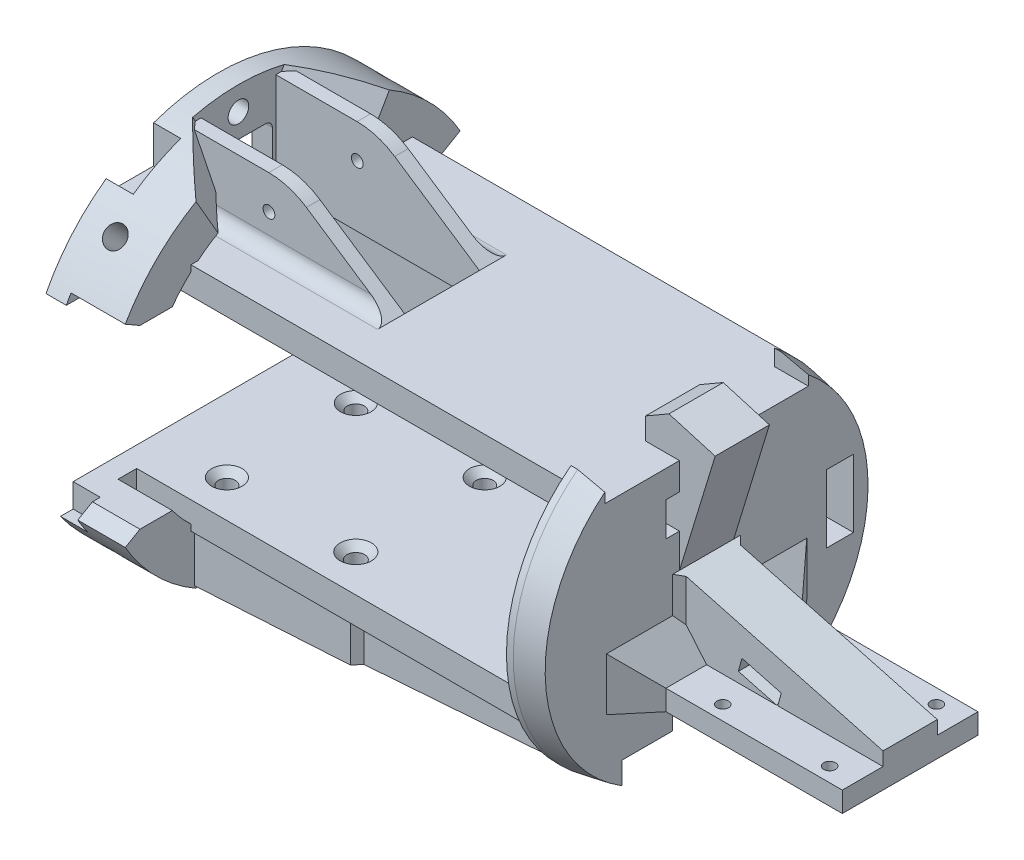
from build123d import *
from OCP.BRepFilletAPI import BRepFilletAPI_MakeChamfer
from build123d.topology import SkipClean

# Parameters (mm, degrees)
SKETCH1_R                 = 36.195
SKETCH1_R_2               = 27.94
SKETCH1_R_3               = 1.9304
BOSS_EXTRUDE1_DEPTH       = 3.81
BOSS_EXTRUDE2_DEPTH       = 10.16
CHAMFER1_SIZE             = 10.16
CHAMFER3_SIZE             = 6.35
BOSS_EXTRUDE3_DEPTH       = 3.81
SKETCH6_W                 = 5.08
SKETCH6_H                 = 38.1
BOSS_EXTRUDE4_DEPTH       = 81.28
SKETCH8_R                 = 31.115
BOSS_EXTRUDE5_DEPTH       = 6.35
CHAMFER2_SIZE             = 5.08
CHAMFER2_SIZE2            = 0.895741062
SKETCH9_W                 = 13.97
SKETCH9_H                 = 33.02
CUT_EXTRUDE2_DEPTH        = 113.797879634
CUT_EXTRUDE1_START        = -6.35
SKETCH4_R                 = 1.9685
CUT_EXTRUDE1_DEPTH        = 8.89
CIRPATTERN1_COUNT         = 4
BOSS_EXTRUDE6_START       = -9.525
SKETCH10_R                = 1.1
BOSS_EXTRUDE6_DEPTH       = 19.05
SKETCH11_W                = 38.1
SKETCH11_H                = 14
CUT_EXTRUDE3_DEPTH        = 17.78
SKETCH14_W                = 36.83
SKETCH14_H                = 8.89
SKETCH14_R                = 1.5875
BOSS_EXTRUDE8_DEPTH       = 3.81
CUT_EXTRUDE4_START        = -8.89
SKETCH15_R                = 1.5875
SKETCH15_R_2              = 1.657039105
CUT_EXTRUDE4_DEPTH        = 8.89
BOSS_EXTRUDE9_DEPTH       = 1.27
BOSS_EXTRUDE10_START      = 33.02
BOSS_EXTRUDE10_DEPTH      = 1.27
CUT_EXTRUDE7_DEPTH        = 115.063394079
CUT_EXTRUDE7_DEPTH_BACK   = 3.81
CHAMFER4_SIZE             = 1.27
CUT_EXTRUDE9_REACH        = 101.3
BOSS_EXTRUDE11_DEPTH      = 1.27
CHAMFER6_SIZE             = 1.27
BOSS_EXTRUDE12_DEPTH      = 1.27
CHAMFER7_SIZE             = 1.27
BOSS_EXTRUDE13_DEPTH      = 5.08
BOSS_EXTRUDE13_DEPTH_BACK = 5.08
CUT_EXTRUDE10_REACH       = 141.575
CHAMFER8_SIZE             = 1.27
CHAMFER9_SIZE             = 3.81
CHAMFER9_SIZE2            = 4.564309419
CUT_EXTRUDE11_REACH       = 106.792
SKETCH28_W                = 6.35
SKETCH28_H                = 2.54
BOSS_EXTRUDE14_REACH      = 101.3
SKETCH29_W                = 43.18
SKETCH29_H                = 3.355694031
CUT_EXTRUDE12_REACH       = 141.287
SKETCH30_R                = 1.27
SKETCH31_R                = 1.5875
SKETCH31_W                = 7.62
SKETCH31_H                = 3.175
CUT_EXTRUDE13_DEPTH       = 3.355694031
CHAMFER10_SIZE            = 0.762
CHAMFER10_SIZE2           = 1.319822715
SKETCH32_W                = 12.7
SKETCH32_H                = 5.08
CUT_EXTRUDE14_DEPTH       = 6.35
SKETCH33_W                = 38.1
SKETCH33_H                = 25.4
BOSS_EXTRUDE15_DEPTH      = 3.81
SKETCH34_R                = 1.1
CUT_EXTRUDE15_DEPTH       = 3.81
CUT_EXTRUDE16_START       = -6.350001
CUT_EXTRUDE16_DEPTH       = 6.350001
CHAMFER11_SIZE            = 5.08
CHAMFER11_SIZE_2          = 6.05410825
CHAMFER12_SIZE            = 5.08
CHAMFER12_SIZE2           = 6.05410825
FILLET1_R                 = 2.54
SKETCH36_W                = 8.89
SKETCH36_H                = 10.16
SKETCH36_W_2              = 10.16
SKETCH36_H_2              = 8.89
CUT_EXTRUDE17_DEPTH       = 5.08


with BuildPart() as part:
    # Sketch1 → Boss-Extrude1 (new body)
    with BuildSketch(Plane.YZ):
        with Locations(Location((0, 0, 0), (0, 0, 90))):
            Circle(SKETCH1_R)
        with Locations(Location((0, 0, 0), (0, 0, 90))):
            Circle(SKETCH1_R_2, mode=Mode.SUBTRACT)
        with Locations(Location((0, -31.75, 0), (0, 0, 90))):
            Circle(SKETCH1_R_3, mode=Mode.SUBTRACT)
        with Locations(Location((-31.75, 0, 0), (0, 0, 90))):
            Circle(SKETCH1_R_3, mode=Mode.SUBTRACT)
        with Locations(Location((0, 31.75, 0), (0, 0, 90))):
            Circle(SKETCH1_R_3, mode=Mode.SUBTRACT)
        with Locations(Location((31.75, 0, 0), (0, 0, 90))):
            Circle(SKETCH1_R_3, mode=Mode.SUBTRACT)
    extrude(amount=BOSS_EXTRUDE1_DEPTH)

    # Sketch2 → Boss-Extrude2 (add)
    with SkipClean():  # the faces are left unmerged after this step: merging them gives an invalid solid
        with BuildSketch(Plane.YZ.offset(3.81)):
            with BuildLine():
                Line((18.0975, 31.34578949), (13.97, 24.196749782))
                ThreePointArc((13.97, 24.196749782), (19.756563466, 19.756563466), (24.196749782, 13.97))
                Line((24.196749782, 13.97), (31.34578949, 18.0975))
                ThreePointArc((31.34578949, 18.0975), (25.593729945, 25.593729945), (18.0975, 31.34578949))
            make_face()
            with BuildLine():
                Line((18.0975, -31.34578949), (13.97, -24.196749782))
                ThreePointArc((13.97, -24.196749782), (19.756563466, -19.756563466), (24.196749782, -13.97))
                Line((24.196749782, -13.97), (31.34578949, -18.0975))
                ThreePointArc((31.34578949, -18.0975), (25.593729945, -25.593729945), (18.0975, -31.34578949))
            make_face()
            with BuildLine():
                Line((-31.34578949, -18.0975), (-24.196749782, -13.97))
                ThreePointArc((-24.196749782, -13.97), (-19.756563466, -19.756563466), (-13.97, -24.196749782))
                Line((-13.97, -24.196749782), (-18.0975, -31.34578949))
                ThreePointArc((-18.0975, -31.34578949), (-25.593729945, -25.593729945), (-31.34578949, -18.0975))
            make_face()
            with BuildLine():
                Line((-18.0975, 31.34578949), (-13.97, 24.196749782))
                ThreePointArc((-13.97, 24.196749782), (-19.756563466, 19.756563466), (-24.196749782, 13.97))
                Line((-24.196749782, 13.97), (-31.34578949, 18.0975))
                ThreePointArc((-31.34578949, 18.0975), (-25.593729945, 25.593729945), (-18.0975, 31.34578949))
            make_face()
        extrude(amount=BOSS_EXTRUDE2_DEPTH)

    # Chamfer1
    # the kernel refuses this chamfer: 10.16 mm, written as the material it adds along each edge
    with BuildSketch(Plane(origin=(3.81, -0.905850421, -1.568978953), x_dir=(0, 0.8660254037844386, -0.49999999999999983), z_dir=(0, -0.4999999999999999, -0.8660254037844387))) as chamfer1_piece_1_section:
        Polygon((CHAMFER1_SIZE, 0), (0, CHAMFER1_SIZE), (0, 0), align=None)
    chamfer1_piece_1 = extrude(amount=60.511598315, mode=Mode.PRIVATE)
    chamfer1_piece_1 = chamfer1_piece_1 & Plane(origin=(3.81, 0, 0), x_dir=(0, 0, 1), z_dir=(-1, 0, 0)) * Cylinder(36.195, 162, mode=Mode.PRIVATE)
    chamfer1_piece_1 = chamfer1_piece_1 - Plane(origin=(3.81, 0, 0), x_dir=(0, 0, 1), z_dir=(-1, 0, 0)) * Cylinder(27.94, 162, mode=Mode.PRIVATE)
    chamfer1_piece_1 = split(chamfer1_piece_1, bisect_by=Plane(origin=(13.97, -0.905850421, -1.568978953), z_dir=(-1, 0, 0)), keep=Keep.TOP, mode=Mode.PRIVATE)
    add(chamfer1_piece_1)
    with BuildSketch(Plane(origin=(3.81, 31.161649579, -53.973560318), x_dir=(0, -0.8660254037844388, -0.49999999999999967), z_dir=(0, -0.49999999999999967, 0.8660254037844388))) as chamfer1_piece_2_section:
        Polygon((CHAMFER1_SIZE, 0), (0, CHAMFER1_SIZE), (0, 0), align=None)
    chamfer1_piece_2 = extrude(amount=60.511598315, mode=Mode.PRIVATE)
    chamfer1_piece_2 = chamfer1_piece_2 & Plane(origin=(3.81, 0, 0), x_dir=(0, 0, 1), z_dir=(-1, 0, 0)) * Cylinder(36.195, 162, mode=Mode.PRIVATE)
    chamfer1_piece_2 = chamfer1_piece_2 - Plane(origin=(3.81, 0, 0), x_dir=(0, 0, 1), z_dir=(-1, 0, 0)) * Cylinder(27.94, 162, mode=Mode.PRIVATE)
    chamfer1_piece_2 = split(chamfer1_piece_2, bisect_by=Plane(origin=(13.97, 31.161649579, -53.973560318), z_dir=(-1, 0, 0)), keep=Keep.TOP, mode=Mode.PRIVATE)
    add(chamfer1_piece_2)
    with BuildSketch(Plane(origin=(3.81, 1.568978953, 0.905850421), x_dir=(0, 0.4999999999999985, -0.8660254037844395), z_dir=(0, 0.8660254037844395, 0.4999999999999985))) as chamfer1_piece_3_section:
        Polygon((CHAMFER1_SIZE, 0), (0, -CHAMFER1_SIZE), (0, 0), align=None)
    chamfer1_piece_3 = extrude(amount=60.511598315, mode=Mode.PRIVATE)
    chamfer1_piece_3 = chamfer1_piece_3 & Plane(origin=(3.81, 0, 0), x_dir=(0, 0, 1), z_dir=(-1, 0, 0)) * Cylinder(36.195, 162, mode=Mode.PRIVATE)
    chamfer1_piece_3 = chamfer1_piece_3 - Plane(origin=(3.81, 0, 0), x_dir=(0, 0, 1), z_dir=(-1, 0, 0)) * Cylinder(27.94, 162, mode=Mode.PRIVATE)
    chamfer1_piece_3 = split(chamfer1_piece_3, bisect_by=Plane(origin=(13.97, 1.568978953, 0.905850421), z_dir=(-1, 0, 0)), keep=Keep.TOP, mode=Mode.PRIVATE)
    add(chamfer1_piece_3)
    with BuildSketch(Plane(origin=(3.81, 1.568978953, -0.905850421), x_dir=(0, 0.49999999999999956, 0.8660254037844389), z_dir=(0, 0.8660254037844389, -0.49999999999999956))) as chamfer1_piece_4_section:
        Polygon((CHAMFER1_SIZE, 0), (0, CHAMFER1_SIZE), (0, 0), align=None)
    chamfer1_piece_4 = extrude(amount=60.511598315, mode=Mode.PRIVATE)
    chamfer1_piece_4 = chamfer1_piece_4 & Plane(origin=(3.81, 0, 0), x_dir=(0, 0, 1), z_dir=(-1, 0, 0)) * Cylinder(36.195, 162, mode=Mode.PRIVATE)
    chamfer1_piece_4 = chamfer1_piece_4 - Plane(origin=(3.81, 0, 0), x_dir=(0, 0, 1), z_dir=(-1, 0, 0)) * Cylinder(27.94, 162, mode=Mode.PRIVATE)
    chamfer1_piece_4 = split(chamfer1_piece_4, bisect_by=Plane(origin=(13.97, 1.568978953, -0.905850421), z_dir=(-1, 0, 0)), keep=Keep.TOP, mode=Mode.PRIVATE)
    add(chamfer1_piece_4)

    # Chamfer3
    # the kernel refuses this chamfer: 6.35, 3.666174209 mm, written as the material it takes off along each edge
    with BuildSketch(Plane(origin=(3.81, -24.196749782, -13.97), x_dir=(0, 0.5581282358487009, -0.8297547061321296), z_dir=(1, 0, 0))) as chamfer3_piece_1:
        with BuildLine():
            Line((3.826432049, 0), (-CHAMFER3_SIZE * 0.0684758777483, -CHAMFER3_SIZE * 0.997652772344))
            Line((-CHAMFER3_SIZE * 0.0684758777483, -CHAMFER3_SIZE * 0.997652772344), (0, 0))
            ThreePointArc((0, 0), (1.984534465, -0.065490518), (3.826432049, 0))
        make_face()
    extrude(amount=26.587994542, mode=Mode.SUBTRACT)
    with BuildSketch(Plane(origin=(3.81, -24.196749782, 13.97), x_dir=(0, 0.5581282358486983, 0.8297547061321314), z_dir=(1, 0, 0))) as chamfer3_piece_2:
        with BuildLine():
            Line((3.826432049, 0), (-CHAMFER3_SIZE * 0.0684758777483, CHAMFER3_SIZE * 0.997652772344))
            Line((-CHAMFER3_SIZE * 0.0684758777483, CHAMFER3_SIZE * 0.997652772344), (0, 0))
            ThreePointArc((0, 0), (1.984534465, 0.065490518), (3.826432049, 0))
        make_face()
    extrude(amount=26.587994542, mode=Mode.SUBTRACT)

    # Sketch5 → Boss-Extrude3 (add)
    with SkipClean():  # the faces are left unmerged after this step: merging them gives an invalid solid
        with BuildSketch(Plane(origin=(0, 0, 0), x_dir=(0, -1, 0), z_dir=(-1, 0, 0))):
            with BuildLine():
                Line((-16.51, -19.05), (16.51, -19.05))
                Line((16.51, -19.05), (16.51, 19.05))
                Line((16.51, 19.05), (16.51, 22.540263974))
                ThreePointArc((16.51, 22.540263974), (0, -27.94), (-16.51, 22.540263974))
                Line((-16.51, 22.540263974), (-16.51, 19.05))
                Line((-16.51, 19.05), (-16.51, -19.05))
            make_face()
        extrude(amount=-BOSS_EXTRUDE3_DEPTH)

    # Sketch6 → Boss-Extrude4 (add)
    with SkipClean():  # the faces are left unmerged after this step: merging them gives an invalid solid
        with BuildSketch(Plane.YZ.offset(3.81)):
            with Locations((-19.05, 0)):
                Rectangle(SKETCH6_W, SKETCH6_H)
            with Locations((19.05, 0)):
                Rectangle(SKETCH6_W, SKETCH6_H)
        extrude(amount=BOSS_EXTRUDE4_DEPTH)
    add(part.part.scale(1), mode=Mode.REPLACE)  # the faces are merged on a copy

    # Sketch8 → Boss-Extrude5 (add)
    with BuildSketch(Plane.YZ.offset(85.09)):
        with Locations(Location((0, 0, 0), (0, 0, 270))):
            Circle(SKETCH8_R)
    extrude(amount=BOSS_EXTRUDE5_DEPTH)

    # Chamfer2
    chamfer2_edges = [part.edges().sort_by_distance(p)[0] for p in [
        (91.44, 0, 31.115),
    ]]
    chamfer2_side = [part.faces().sort_by_distance(p)[0] for p in [
        (88.265, 0, 31.115),
    ]]
    chamfer(chamfer2_edges, length=CHAMFER2_SIZE, length2=CHAMFER2_SIZE2, reference=chamfer2_side[0])

    # Sketch9 → Cut-Extrude2 (cut, through all)
    with SkipClean():  # the faces are left unmerged after this step: merging them gives an invalid solid
        with BuildSketch(Plane.XY.offset(-19.05)):
            with Locations((6.985, 0)):
                Rectangle(SKETCH9_W, SKETCH9_H)
        extrude(amount=CUT_EXTRUDE2_DEPTH, mode=Mode.SUBTRACT)

    # Sketch4 → Cut-Extrude1 (cut)
    with SkipClean():  # the faces are left unmerged after this step: merging them gives an invalid solid
        with BuildSketch(Plane(origin=(0, 24.721644745, 24.721644745), x_dir=(1, 0, 0), z_dir=(0, 0.7071067811865476, 0.7071067811865475)).offset(CUT_EXTRUDE1_START)):
            with Locations(Location((6.35, 0, 0), (0, 0, 90))):
                Circle(SKETCH4_R)
        cut_extrude1 = extrude(amount=CUT_EXTRUDE1_DEPTH, mode=Mode.SUBTRACT)

    # CirPattern1: Cut-Extrude1 ×4 about axis
    with SkipClean():  # the faces are left unmerged after this step: merging them gives an invalid solid
        cirpattern1_axis = Axis((0, 0, 0), (1, 0, 0))
        for i in range(1, CIRPATTERN1_COUNT):
            add(cut_extrude1.rotate(cirpattern1_axis, i * 360 / CIRPATTERN1_COUNT), mode=Mode.SUBTRACT)

    # Sketch10 → Boss-Extrude6 (add)
    with SkipClean():  # the faces are left unmerged after this step: merging them gives an invalid solid
        with BuildSketch(Plane.XY.offset(19.05).offset(BOSS_EXTRUDE6_START)):
            with BuildLine():
                Line((3.81, 34.29), (19.014749401, 34.29))
                ThreePointArc((19.014749401, 34.29), (22.695008089, 33.745068736), (26.059441893, 32.157038738))
                Line((26.059441893, 32.157038738), (41.91, 21.59))
                Line((41.91, 21.59), (3.81, 21.59))
                Line((3.81, 21.59), (3.81, 34.29))
            make_face()
            with Locations((19.05, 27.94)):
                Circle(SKETCH10_R, mode=Mode.SUBTRACT)
        extrude(amount=-BOSS_EXTRUDE6_DEPTH)

    # Sketch11 → Cut-Extrude3 (cut)
    with SkipClean():  # the faces are left unmerged after this step: merging them gives an invalid solid
        with BuildSketch(Plane(origin=(0, 34.29, 0), x_dir=(-1, 0, 0), z_dir=(0, 1, 0))):
            with Locations((-22.86, 0)):
                Rectangle(SKETCH11_W, SKETCH11_H)
        extrude(amount=-CUT_EXTRUDE3_DEPTH, mode=Mode.SUBTRACT)

    # Sketch14 → Boss-Extrude8 (add)
    # profile 1 of 2: a face of its own
    with SkipClean():  # the faces are left unmerged after this step: merging them gives an invalid solid
        with BuildSketch(Plane.XZ.offset(21.59)):
            with Locations((22.225, 12.7)):
                Rectangle(SKETCH14_W, SKETCH14_H)
            with Locations(Location((37.846, 12.065, 0), (0, 0, 90))):
                Circle(SKETCH14_R, mode=Mode.SUBTRACT)
            with Locations(Location((13.716, 12.065, 0), (0, 0, 90))):
                Circle(SKETCH14_R, mode=Mode.SUBTRACT)
        # profile 2 of 2: a face of its own
        with BuildSketch(Plane.XZ.offset(21.59)):
            with Locations((22.225, -12.7)):
                Rectangle(SKETCH14_W, SKETCH14_H)
            with Locations(Location((13.716, -12.065, 0), (0, 0, 90))):
                Circle(SKETCH14_R, mode=Mode.SUBTRACT)
            with Locations(Location((37.846, -12.065, 0), (0, 0, 90))):
                Circle(SKETCH14_R, mode=Mode.SUBTRACT)
        extrude(amount=BOSS_EXTRUDE8_DEPTH)

    # Sketch15 → Cut-Extrude4 (cut)
    with SkipClean():  # the faces are left unmerged after this step: merging them gives an invalid solid
        with BuildSketch(Plane.XZ.offset(25.4).offset(CUT_EXTRUDE4_START)):
            with Locations(Location((13.716, 12.065, 0), (0, 0, 90))):
                Circle(SKETCH15_R)
            with Locations(Location((37.846, 12.065, 0), (0, 0, 270))):
                Circle(SKETCH15_R_2)
            with Locations(Location((37.846, -12.065, 0), (0, 0, 90))):
                Circle(SKETCH15_R)
            with Locations(Location((13.716, -12.065, 0), (0, 0, 90))):
                Circle(SKETCH15_R)
        extrude(amount=CUT_EXTRUDE4_DEPTH, mode=Mode.SUBTRACT)

    # Sketch18 → Boss-Extrude9 (add)
    with SkipClean():  # the faces are left unmerged after this step: merging them gives an invalid solid
        with BuildSketch(Plane(origin=(0, 0, 17.145), x_dir=(1, 0, 0), z_dir=(0, 0, -1))):
            Polygon((85.09, 25.965211341), (85.09, 21.59), (40.64, 21.59), (40.64, 29.198082411), align=None)
        extrude(amount=BOSS_EXTRUDE9_DEPTH)

    # Sketch20 → Boss-Extrude10 (add)
    with SkipClean():  # the faces are left unmerged after this step: merging them gives an invalid solid
        with BuildSketch(Plane(origin=(0, 0, 15.875), x_dir=(1, 0, 0), z_dir=(0, 0, -1)).offset(BOSS_EXTRUDE10_START)):
            Polygon((40.64, 21.59), (40.64, 29.198082411), (85.09, 25.965211341), (85.09, 21.59), align=None)
        extrude(amount=-BOSS_EXTRUDE10_DEPTH)

    # Sketch21 → Cut-Extrude7 (cut, two sides: drawn at the far end of the back side and taken through both)
    with SkipClean():  # the faces are left unmerged after this step: merging them gives an invalid solid
        with BuildSketch(Plane.XZ.offset(21.59).offset(-CUT_EXTRUDE7_DEPTH_BACK)):
            with BuildLine():
                Line((36.398522628, 6.35), (91.44, 6.35))
                Line((91.44, 6.35), (91.44, -6.35))
                Line((91.44, -6.35), (36.398522628, -6.35))
                ThreePointArc((36.398522628, -6.35), (12.7, 0), (36.398522628, 6.35))
            make_face()
        extrude(amount=CUT_EXTRUDE7_DEPTH + CUT_EXTRUDE7_DEPTH_BACK, mode=Mode.SUBTRACT)
    add(part.part.scale(1), mode=Mode.REPLACE)  # the faces are merged on a copy

    # Chamfer4
    chamfer4_edges = [part.edges().sort_by_distance(p)[0] for p in [
        (12.133621195, -16.51, -12.192411022),
        (37.846, -16.51, -13.6525),
        (37.846, -16.51, 13.722039105),
        (12.133621195, -16.51, 11.937588978),
    ]]
    chamfer(chamfer4_edges, length=CHAMFER4_SIZE)

    # Sketch23 → Cut-Extrude9 (cut, up to next)
    with BuildSketch(Plane(origin=(85.09, 0, 0), x_dir=(0, -1, 0), z_dir=(-1, 0, 0)), mode=Mode.PRIVATE) as cut_extrude9_sk1:
        with BuildLine():
            Line((-24.601640697, 19.05), (-21.59, 19.05))
            Line((-21.59, 19.05), (-21.59, -19.05))
            Line((-21.59, -19.05), (-24.601640697, -19.05))
            ThreePointArc((-24.601640697, -19.05), (-31.115, 0), (-24.601640697, 19.05))
        make_face()
    cut_extrude9_tool1 = extrude(cut_extrude9_sk1.sketch, amount=-CUT_EXTRUDE9_REACH, mode=Mode.PRIVATE) & part.part
    add(cut_extrude9_tool1.solids().sort_by_distance((85.09, 25.56073, 0))[0], mode=Mode.SUBTRACT)

    # Sketch24 → Boss-Extrude11 (add)
    with SkipClean():  # the faces are left unmerged after this step: merging them gives an invalid solid
        with BuildSketch(Plane.XY.offset(17.145)):
            Polygon((43.18, -29.013346921), (3.81, -31.34578949), (3.81, -21.59), (43.18, -21.59), align=None)
        extrude(amount=BOSS_EXTRUDE11_DEPTH)

    # Chamfer6
    # the kernel refuses this chamfer: 1.27 mm, written as the material it adds along each edge
    with BuildSketch(Plane(origin=(43.18, -18.323962605, 17.145), x_dir=(1, 0, 0), z_dir=(0, -1, 0))) as chamfer6_piece_1_section:
        Polygon((CHAMFER6_SIZE, 0), (0, CHAMFER6_SIZE), (0, 0), align=None)
    chamfer6_piece_1 = extrude(amount=13.95542171, mode=Mode.PRIVATE)
    chamfer6_piece_1 = split(chamfer6_piece_1, bisect_by=Plane(origin=(43.95335352, -28.957100527, 17.145), z_dir=(-0.07253890529908057, 0.9973655835339473, -1.812888966709246e-15)), keep=Keep.TOP, mode=Mode.PRIVATE)
    add(chamfer6_piece_1)
    with BuildSketch(Plane(origin=(40.64, -22.133962605, 17.145), x_dir=(-1, 0, 0), z_dir=(0, -1, 0))) as chamfer6_piece_2_section:
        Polygon((CHAMFER6_SIZE, 0), (0, CHAMFER6_SIZE), (0, 0), align=None)
    chamfer6_piece_2 = extrude(amount=10.295901876, mode=Mode.PRIVATE)
    chamfer6_piece_2 = split(chamfer6_piece_2, bisect_by=Plane(origin=(41.055021742, -29.139239472, 17.145), z_dir=(-0.059140462969697195, 0.9982496709940505, 0)), keep=Keep.TOP, mode=Mode.PRIVATE)
    add(chamfer6_piece_2)

    # Sketch25 → Boss-Extrude12 (add)
    with SkipClean():  # the faces are left unmerged after this step: merging them gives an invalid solid
        with BuildSketch(Plane(origin=(0, 0, -17.145), x_dir=(1, 0, 0), z_dir=(0, 0, -1))):
            Polygon((43.18, 29.013346921), (3.81, 31.34578949), (3.81, 21.59), (43.18, 21.59), align=None)
        extrude(amount=BOSS_EXTRUDE12_DEPTH)

    # Chamfer7
    # the kernel refuses this chamfer: 1.27 mm, written as the material it adds along each edge
    with BuildSketch(Plane(origin=(40.64, -22.133962605, -17.145), x_dir=(-1, 0, 0), z_dir=(0, -1, 0))) as chamfer7_piece_1_section:
        Polygon((CHAMFER7_SIZE, 0), (0, -CHAMFER7_SIZE), (0, 0), align=None)
    chamfer7_piece_1 = extrude(amount=10.295901876, mode=Mode.PRIVATE)
    chamfer7_piece_1 = split(chamfer7_piece_1, bisect_by=Plane(origin=(41.055021742, -29.139239472, -17.145), z_dir=(-0.059140462969697195, 0.9982496709940505, 0)), keep=Keep.TOP, mode=Mode.PRIVATE)
    add(chamfer7_piece_1)
    with BuildSketch(Plane(origin=(43.18, -18.323962605, -17.145), x_dir=(0, 0, -1), z_dir=(0, -1, 0))) as chamfer7_piece_2_section:
        Polygon((CHAMFER7_SIZE, 0), (0, CHAMFER7_SIZE), (0, 0), align=None)
    chamfer7_piece_2 = extrude(amount=13.95542171, mode=Mode.PRIVATE)
    chamfer7_piece_2 = split(chamfer7_piece_2, bisect_by=Plane(origin=(43.95335352, -28.957100527, -17.145), z_dir=(-0.07253890529908057, 0.9973655835339473, -2.0261072986436667e-15)), keep=Keep.TOP, mode=Mode.PRIVATE)
    add(chamfer7_piece_2)

    # Sketch26 → Boss-Extrude13 (add, two sides: drawn at the far end of the back side and taken through both)
    with SkipClean():  # the faces are left unmerged after this step: merging them gives an invalid solid
        with BuildSketch(Plane(origin=(0, 0, 0), x_dir=(0, 1, 0), z_dir=(0, 0, 1)).offset(-BOSS_EXTRUDE13_DEPTH_BACK)):
            Polygon((3.792873279, -91.44), (-6.415990953, -129.54), (-12.765990953, -129.54), (-12.765990953, -85.09), (29.464, -85.09), (25.654, -98.12361717), align=None)
        extrude(amount=BOSS_EXTRUDE13_DEPTH + BOSS_EXTRUDE13_DEPTH_BACK)

    # Sketch27 → Cut-Extrude10 (cut, up to next)
    with BuildSketch(Plane(origin=(0, 0, -5.08), x_dir=(1, 0, 0), z_dir=(0, 0, -1)), mode=Mode.PRIVATE) as cut_extrude10_sk1:
        Polygon((103.129645204, 4.59856071), (110.49, 6.570761834), (109.832599625, 9.024213432), (102.472244829, 7.052012309), align=None)
    cut_extrude10_tool1 = extrude(cut_extrude10_sk1.sketch, amount=-CUT_EXTRUDE10_REACH, mode=Mode.PRIVATE) & part.part
    add(cut_extrude10_tool1.solids().sort_by_distance((106.481122, -6.811387, -5.08))[0], mode=Mode.SUBTRACT)

    # Chamfer8
    # the kernel refuses this chamfer: 1.27 mm, written as the material it adds along each edge
    with BuildSketch(Plane(origin=(91.44, -12.765990953, -5.08), x_dir=(0, 0, -1), z_dir=(0, 1, 0))) as chamfer8_piece_1_section:
        Polygon((CHAMFER8_SIZE, 0), (0, -CHAMFER8_SIZE), (0, 0), align=None)
    chamfer8_piece_1 = extrude(amount=22.111127803, mode=Mode.PRIVATE)
    chamfer8_piece_1 = split(chamfer8_piece_1, bisect_by=Plane(origin=(95.579716058, 2.683639704, -5.08), z_dir=(-0.25881904510251785, -0.9659258262890691, 0)), keep=Keep.TOP, mode=Mode.PRIVATE)
    add(chamfer8_piece_1)
    with BuildSketch(Plane(origin=(91.44, -12.765990953, 5.08), x_dir=(0, 0, 1), z_dir=(0, 1, 0))) as chamfer8_piece_2_section:
        Polygon((CHAMFER8_SIZE, 0), (0, CHAMFER8_SIZE), (0, 0), align=None)
    chamfer8_piece_2 = extrude(amount=22.111127803, mode=Mode.PRIVATE)
    chamfer8_piece_2 = split(chamfer8_piece_2, bisect_by=Plane(origin=(95.579716058, 2.683639704, 5.08), z_dir=(-0.25881904510251785, -0.9659258262890691, 0)), keep=Keep.TOP, mode=Mode.PRIVATE)
    add(chamfer8_piece_2)

    # Chamfer9
    chamfer9_edges = [part.edges().sort_by_distance(p)[0] for p in [
        (85.09, 29.464, 0),
    ]]
    chamfer9_side = [part.faces().sort_by_distance(p)[0] for p in [
        (85.09, 25.527, 0),
    ]]
    chamfer(chamfer9_edges, length=CHAMFER9_SIZE, length2=CHAMFER9_SIZE2, reference=chamfer9_side[0])

    # Sketch28 → Cut-Extrude11 (cut, up to next)
    with BuildSketch(Plane.YZ.offset(91.44), mode=Mode.PRIVATE) as cut_extrude11_sk1:
        with Locations((13.335, 6.35)):
            Rectangle(SKETCH28_W, SKETCH28_H)
    cut_extrude11_tool1 = extrude(cut_extrude11_sk1.sketch, amount=-CUT_EXTRUDE11_REACH, mode=Mode.PRIVATE) & part.part
    # Sketch28 → Cut-Extrude11 (cut, up to next)
    with BuildSketch(Plane.YZ.offset(91.44), mode=Mode.PRIVATE) as cut_extrude11_sk2:
        with Locations((13.335, -6.35)):
            Rectangle(SKETCH28_W, SKETCH28_H)
    cut_extrude11_tool2 = extrude(cut_extrude11_sk2.sketch, amount=-CUT_EXTRUDE11_REACH, mode=Mode.PRIVATE) & part.part
    add(cut_extrude11_tool1.solids().sort_by_distance((91.44, 13.335, 6.35))[0], mode=Mode.SUBTRACT)
    add(cut_extrude11_tool2.solids().sort_by_distance((91.44, 13.335, -6.35))[0], mode=Mode.SUBTRACT)

    # Boss-Extrude14: up to this face of the body (flat: up to its plane)
    boss_extrude14_end = Plane(part.part.faces().sort_by_distance((3.81, -29.009691657, 0))[0])
    # Sketch29 → Boss-Extrude14 (add, up to the picked face)
    with BuildSketch(Plane(origin=(85.09, 0, 0), x_dir=(0, -1, 0), z_dir=(-1, 0, 0)), mode=Mode.PRIVATE) as boss_extrude14_sk1:
        with Locations((0, -20.727847016)):
            Rectangle(SKETCH29_W, SKETCH29_H)
    boss_extrude14_tool1 = split(extrude(boss_extrude14_sk1.sketch, amount=BOSS_EXTRUDE14_REACH, mode=Mode.PRIVATE), bisect_by=boss_extrude14_end, keep=Keep.BOTH, mode=Mode.PRIVATE)
    add(boss_extrude14_tool1.solids().sort_by(Axis((85.09, 0, -20.727847), (-1, 0, 0)))[0])

    # Sketch30 → Cut-Extrude12 (cut, up to next)
    with BuildSketch(Plane(origin=(0, 0, 0), x_dir=(0, -1, 0), z_dir=(-1, 0, 0)), mode=Mode.PRIVATE) as cut_extrude12_sk1:
        with Locations(Location((23.495, 0, 0), (0, 0, 90))):
            Circle(SKETCH30_R)
    cut_extrude12_tool1 = extrude(cut_extrude12_sk1.sketch, amount=-CUT_EXTRUDE12_REACH, mode=Mode.PRIVATE) & part.part
    # Sketch30 → Cut-Extrude12 (cut, up to next)
    with BuildSketch(Plane(origin=(0, 0, 0), x_dir=(0, -1, 0), z_dir=(-1, 0, 0)), mode=Mode.PRIVATE) as cut_extrude12_sk2:
        with BuildLine():
            Line((-26.035, -6.35), (-20.955, -6.35))
            ThreePointArc((-20.955, -6.35), (-20.056974388, -5.978025612), (-19.685, -5.08))
            Line((-19.685, -5.08), (-19.685, 5.08))
            ThreePointArc((-19.685, 5.08), (-20.056974388, 5.978025612), (-20.955, 6.35))
            Line((-20.955, 6.35), (-26.035, 6.35))
            ThreePointArc((-26.035, 6.35), (-26.933025612, 5.978025612), (-27.305, 5.08))
            Line((-27.305, 5.08), (-27.305, -5.08))
            ThreePointArc((-27.305, -5.08), (-26.933025612, -5.978025612), (-26.035, -6.35))
        make_face()
    cut_extrude12_tool2 = extrude(cut_extrude12_sk2.sketch, amount=-CUT_EXTRUDE12_REACH, mode=Mode.PRIVATE) & part.part
    add(cut_extrude12_tool1.solids().sort_by_distance((0, -23.495, 0))[0], mode=Mode.SUBTRACT)
    add(cut_extrude12_tool2.solids().sort_by_distance((0, 23.495, 0))[0], mode=Mode.SUBTRACT)

    # Sketch31 → Cut-Extrude13 (cut)
    with SkipClean():  # the faces are left unmerged after this step: merging them gives an invalid solid
        with BuildSketch(Plane(origin=(0, 0, -22.405694031), x_dir=(1, 0, 0), z_dir=(0, 0, -1))):
            with Locations(Location((60.021234746, 12.385288595, 0), (0, 0, 180))):
                Circle(SKETCH31_R)
            with Locations(Location((79.678765254, -12.385288595, 0), (0, 0, 180))):
                Circle(SKETCH31_R)
            with Locations((29.21, 14.2875)):
                Rectangle(SKETCH31_W, SKETCH31_H)
            with Locations((29.21, -14.2875)):
                Rectangle(SKETCH31_W, SKETCH31_H)
        extrude(amount=-CUT_EXTRUDE13_DEPTH, mode=Mode.SUBTRACT)

    # Chamfer10: one chamfer whose edges measure the first distance from different faces: ONE call of the kernel's chamfer builder (chamfer() names one face for all edges)
    chamfer10_edges_1 = [part.edges().sort_by_distance(p)[0] for p in [
        (81.266265254, 12.385288595, -19.05),
    ]]
    chamfer10_side_1 = [part.faces().sort_by_distance(p)[0] for p in [
        (81.266265254, 12.385288595, -20.727847015),
    ]]
    chamfer10_edges_2 = [part.edges().sort_by_distance(p)[0] for p in [
        (61.608734746, -12.385288595, -19.05),
    ]]
    chamfer10_side_2 = [part.faces().sort_by_distance(p)[0] for p in [
        (61.608734746, -12.385288595, -20.727847015),
    ]]
    chamfer10 = BRepFilletAPI_MakeChamfer(part.part.solid().wrapped)
    for e in chamfer10_edges_1:
        chamfer10.Add(CHAMFER10_SIZE, CHAMFER10_SIZE2, e.wrapped, chamfer10_side_1[0].wrapped)  # the first distance lies on this face
    for e in chamfer10_edges_2:
        chamfer10.Add(CHAMFER10_SIZE, CHAMFER10_SIZE2, e.wrapped, chamfer10_side_2[0].wrapped)  # the first distance lies on this face
    add(Compound.cast(chamfer10.Shape()), mode=Mode.REPLACE)

    # Sketch32 → Cut-Extrude14 (cut)
    with SkipClean():  # the faces are left unmerged after this step: merging them gives an invalid solid
        with BuildSketch(Plane(origin=(85.09, 0, 0), x_dir=(0, -1, 0), z_dir=(-1, 0, 0))):
            with Locations((0, -24.945694031)):
                Rectangle(SKETCH32_W, SKETCH32_H)
        extrude(amount=-CUT_EXTRUDE14_DEPTH, mode=Mode.SUBTRACT)

    # Sketch33 → Boss-Extrude15 (add)
    with SkipClean():  # the faces are left unmerged after this step: merging them gives an invalid solid
        with BuildSketch(Plane.XZ.offset(12.765990953)):
            with Locations((110.49, 0)):
                Rectangle(SKETCH33_W, SKETCH33_H)
        extrude(amount=-BOSS_EXTRUDE15_DEPTH)

    # Sketch34 → Cut-Extrude15 (cut)
    with SkipClean():  # the faces are left unmerged after this step: merging them gives an invalid solid
        with BuildSketch(Plane.XZ.offset(12.765990953)):
            with Locations((104.46, 10)):
                Circle(SKETCH34_R)
            with Locations((124.46, 10)):
                Circle(SKETCH34_R)
            with Locations((124.46, -10)):
                Circle(SKETCH34_R)
            with Locations((104.46, -10)):
                Circle(SKETCH34_R)
        extrude(amount=-CUT_EXTRUDE15_DEPTH, mode=Mode.SUBTRACT)

    # Sketch35 → Cut-Extrude16 (cut)
    with SkipClean():  # the faces are left unmerged after this step: merging them gives an invalid solid
        with BuildSketch(Plane(origin=(85.09, 0, 0), x_dir=(0, -1, 0), z_dir=(-1, 0, 0)).offset(CUT_EXTRUDE16_START)):
            with BuildLine():
                Line((26.760560532, 15.875), (21.59, 15.875))
                Line((21.59, 15.875), (21.59, -15.875))
                Line((21.59, -15.875), (26.760560532, -15.875))
                ThreePointArc((26.760560532, -15.875), (31.115, 0), (26.760560532, 15.875))
            make_face()
        extrude(amount=CUT_EXTRUDE16_DEPTH, mode=Mode.SUBTRACT)

    # Chamfer11
    # the kernel refuses this chamfer: 6.05410825, 5.08 mm, written as the material it takes off along each edge
    with BuildSketch(Plane(origin=(91.44, -17.78, 6.35), x_dir=(0, 1, 0), z_dir=(0, 0, -1))) as chamfer11_piece_1_section:
        Polygon((CHAMFER11_SIZE, 0), (0, -CHAMFER11_SIZE_2), (0, 0), align=None)
    chamfer11_piece_1 = extrude(amount=12.7, mode=Mode.PRIVATE)
    chamfer11_piece_1 = split(chamfer11_piece_1, bisect_by=Plane(origin=(91.44, -12.765990953, 6.35), z_dir=(0, -1, 0)), keep=Keep.TOP, mode=Mode.PRIVATE)
    add(chamfer11_piece_1, mode=Mode.SUBTRACT)

    # Chamfer12: one chamfer whose edges measure the first distance from different faces: ONE call of the kernel's chamfer builder (chamfer() names one face for all edges)
    chamfer12_edges_1 = [part.edges().sort_by_distance(p)[0] for p in [
        (91.44, -10.860990953, 12.7),
    ]]
    chamfer12_side_1 = [part.faces().sort_by_distance(p)[0] for p in [
        (110.49, -10.860990953, 12.7),
    ]]
    chamfer12_edges_2 = [part.edges().sort_by_distance(p)[0] for p in [
        (91.44, -8.955990953, 9.525),
        (91.44, -8.955990953, -9.525),
    ]]
    chamfer12_side_2 = [part.faces().sort_by_distance(p)[0] for p in [
        (91.897905012, -8.955990953, -9.525),
    ]]
    chamfer12_edges_3 = [part.edges().sort_by_distance(p)[0] for p in [
        (91.44, -10.860990953, -12.7),
    ]]
    chamfer12_side_3 = [part.faces().sort_by_distance(p)[0] for p in [
        (110.49, -10.860990953, -12.7),
    ]]
    chamfer12 = BRepFilletAPI_MakeChamfer(part.part.solid().wrapped)
    for e in chamfer12_edges_1:
        chamfer12.Add(CHAMFER12_SIZE, CHAMFER12_SIZE2, e.wrapped, chamfer12_side_1[0].wrapped)  # the first distance lies on this face
    for e in chamfer12_edges_2:
        chamfer12.Add(CHAMFER12_SIZE, CHAMFER12_SIZE2, e.wrapped, chamfer12_side_2[0].wrapped)  # the first distance lies on this face
    for e in chamfer12_edges_3:
        chamfer12.Add(CHAMFER12_SIZE, CHAMFER12_SIZE2, e.wrapped, chamfer12_side_3[0].wrapped)  # the first distance lies on this face
    add(Compound.cast(chamfer12.Shape()), mode=Mode.REPLACE)

    # Fillet1
    fillet1_edges = [part.edges().sort_by_distance(p)[0] for p in [
        (22.86, 21.59, -9.525),
        (22.86, 21.59, 9.525),
    ]]
    fillet(fillet1_edges, radius=FILLET1_R)

    # Sketch36 → Cut-Extrude17 (cut)
    with SkipClean():  # the faces are left unmerged after this step: merging them gives an invalid solid
        with BuildSketch(Plane(origin=(0, 0, 0), x_dir=(0, -1, 0), z_dir=(-1, 0, 0))):
            with Locations((16.51, 32.210214607)):
                Rectangle(SKETCH36_W, SKETCH36_H)
            with Locations((-32.210214607, 16.51)):
                Rectangle(SKETCH36_W_2, SKETCH36_H_2)
            with Locations((32.210214607, -16.51)):
                Rectangle(SKETCH36_W_2, SKETCH36_H_2)
            with Locations((-16.51, -32.210214607)):
                Rectangle(SKETCH36_W, SKETCH36_H)
        extrude(amount=-CUT_EXTRUDE17_DEPTH, mode=Mode.SUBTRACT)


solid = part.part
